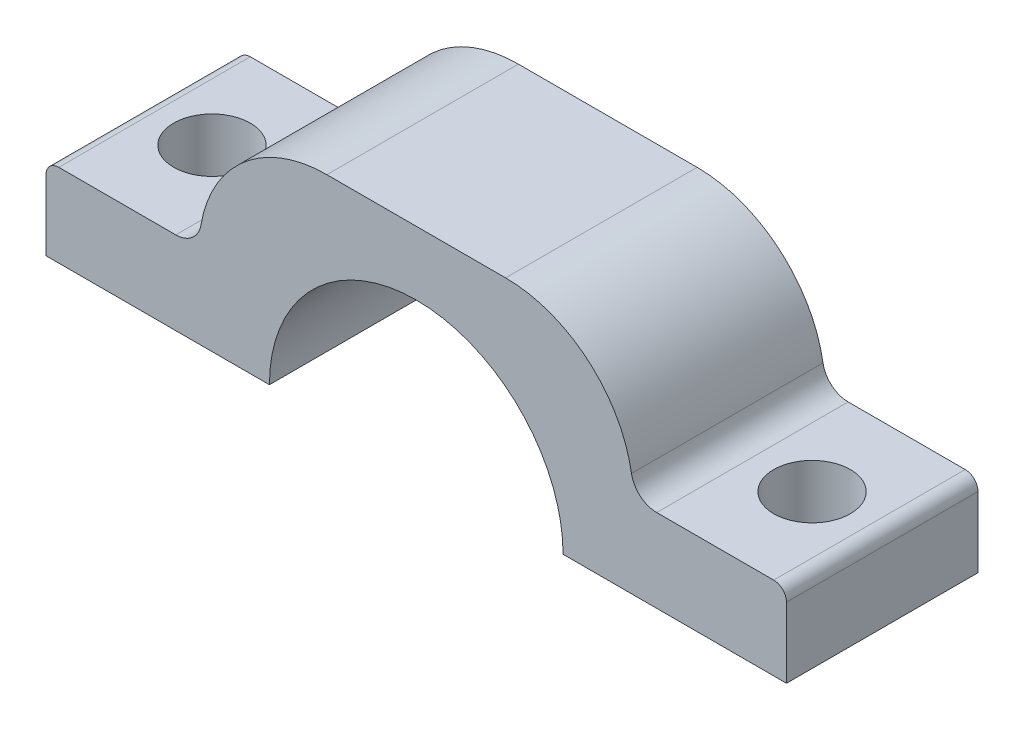
from build123d import *

# Parameters (mm, degrees)
DODANIE_WYCI_GNI_CIE1_DEPTH = 15
ZAOKR_GLENIE1_R             = 2
OTWORY_USTALAJ_CE_6_0MM3_D  = 6
ZAOKR_GLENIE2_R             = 1


with BuildPart() as part:
    # Szkic1 → Dodanie-wyciągnięcie1 (new body)
    with BuildSketch(Plane.XY):
        with BuildLine():
            Line((-29, 0), (-29, 6.5))
            Line((-29, 6.5), (-17, 6.5))
            ThreePointArc((-17, 6.5), (-14.071067812, 13.571067812), (-7, 16.5))
            Line((-7, 16.5), (7, 16.5))
            ThreePointArc((7, 16.5), (14.071067812, 13.571067812), (17, 6.5))
            Line((17, 6.5), (29, 6.5))
            Line((29, 6.5), (29, 0))
            Line((29, 0), (11.5, 0))
            ThreePointArc((11.5, 0), (0, 11.5), (-11.5, 0))
            Line((-11.5, 0), (-29, 0))
        make_face()
    extrude(amount=DODANIE_WYCI_GNI_CIE1_DEPTH)

    # Zaokrąglenie1
    zaokr_glenie1_edges = [part.edges().sort_by_distance(p)[0] for p in [
        (17, 6.5, 7.5),
        (-17, 6.5, 7.5),
    ]]
    fillet(zaokr_glenie1_edges, radius=ZAOKR_GLENIE1_R)

    # Otwory ustalające Ø6.0mm3 (through all)
    with Locations(Plane(origin=(0, 6.5, 0), x_dir=(1, 0, 0), z_dir=(0, 1, 0))):
        with Locations((-23.5, -7.5)):
            otwory_ustalaj_ce_6_0mm3 = Hole(OTWORY_USTALAJ_CE_6_0MM3_D / 2)

    # Lustro1: Otwory ustalające Ø6.0mm3 across plane
    add(otwory_ustalaj_ce_6_0mm3.mirror(Plane(origin=(0, 0, 0), x_dir=(0, 0, 1), z_dir=(1, 0, 0))), mode=Mode.SUBTRACT)

    # Zaokrąglenie2
    zaokr_glenie2_edges = [part.edges().sort_by_distance(p)[0] for p in [
        (29, 6.5, 7.5),
        (-29, 6.5, 7.5),
    ]]
    fillet(zaokr_glenie2_edges, radius=ZAOKR_GLENIE2_R)


solid = part.part
